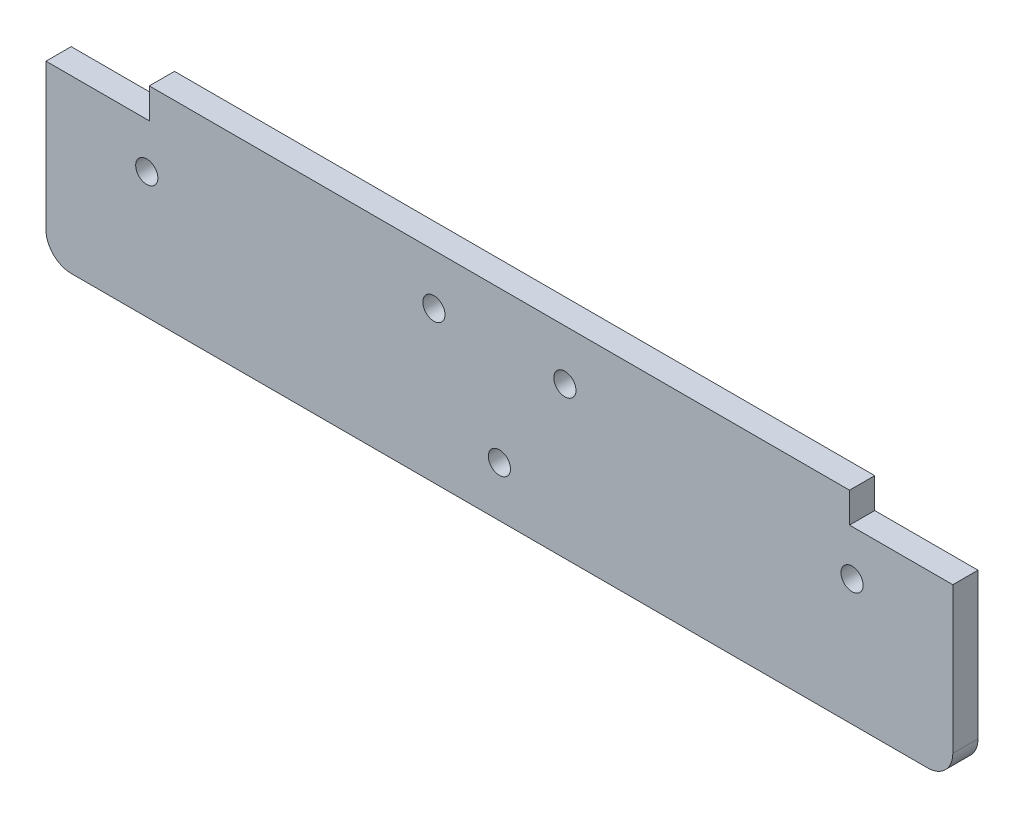
from build123d import *

# Parameters (mm, degrees)
SZKIC1_W                    = 180
SZKIC1_H                    = 40
DODANIE_WYCI_GNI_CIE1_DEPTH = 5
ZAOKR_GLENIE1_R             = 5
SZKIC2_R                    = 2.2
WYTNIJ_WYCI_GNI_CIE1_DEPTH  = 5
SZKIC3_W                    = 20.5
SZKIC3_H                    = 6
WYTNIJ_WYCI_GNI_CIE2_DEPTH  = 10
SZKIC4_R                    = 2.2
WYTNIJ_WYCI_GNI_CIE3_DEPTH  = 10


with BuildPart() as part:
    # Szkic1 → Dodanie-wyciągnięcie1 (new body)
    with BuildSketch(Plane.XY):
        Rectangle(SZKIC1_W, SZKIC1_H)
    extrude(amount=DODANIE_WYCI_GNI_CIE1_DEPTH)

    # Zaokrąglenie1
    zaokr_glenie1_edges = [part.edges().sort_by_distance(p)[0] for p in [
        (-90, 20, 2.5),
        (-90, -20, 2.5),
        (90, -20, 2.5),
        (90, 20, 2.5),
    ]]
    fillet(zaokr_glenie1_edges, radius=ZAOKR_GLENIE1_R)

    # Szkic2 → Wytnij-wyciągnięcie1 (cut)
    with BuildSketch(Plane.XY.offset(5)):
        with Locations((-70, 5)):
            Circle(SZKIC2_R)
        with Locations((-13, 10)):
            Circle(SZKIC2_R)
        with Locations((13, 10)):
            Circle(SZKIC2_R)
        with Locations((70, 5)):
            Circle(SZKIC2_R)
    extrude(amount=-WYTNIJ_WYCI_GNI_CIE1_DEPTH, mode=Mode.SUBTRACT)

    # Szkic3 → Wytnij-wyciągnięcie2 (cut)
    with BuildSketch(Plane.XY.offset(5)):
        with Locations((-79.75, 17)):
            Rectangle(SZKIC3_W, SZKIC3_H)
        with Locations((79.75, 17)):
            Rectangle(SZKIC3_W, SZKIC3_H)
    extrude(amount=-WYTNIJ_WYCI_GNI_CIE2_DEPTH, mode=Mode.SUBTRACT)

    # Szkic4 → Wytnij-wyciągnięcie3 (cut)
    with BuildSketch(Plane.XY.offset(5)):
        with Locations((0, -10)):
            Circle(SZKIC4_R)
    extrude(amount=-WYTNIJ_WYCI_GNI_CIE3_DEPTH, mode=Mode.SUBTRACT)


solid = part.part
